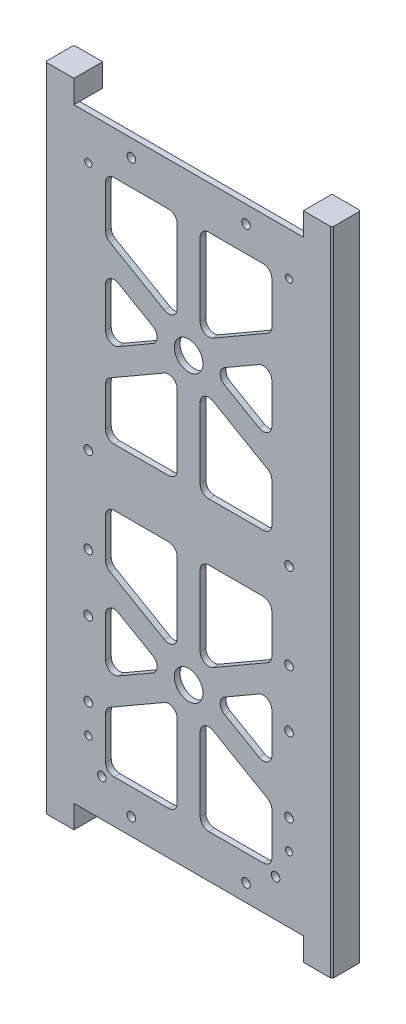
from build123d import *

# Parameters (mm, degrees)
SKETCH1_W                   = 88
SKETCH1_H                   = 211
BOSS_EXTRUDE1_DEPTH         = 2
CUT_EXTRUDE2_DEPTH          = 2
SKETCH4_R                   = 5
CUT_EXTRUDE3_DEPTH          = 229.624145706
FILLET2_R                   = 3
BOSS_EXTRUDE2_DEPTH         = 10
CUT_EXTRUDE5_DEPTH          = 8
SKETCH58_R                  = 1.665
CUT_EXTRUDE9_DEPTH          = 1.8
SKETCH59_R                  = 2
CUT_EXTRUDE10_DEPTH         = 10
FILLET3_SIZE                = 0.5
F_3_0MM_DOWEL_HOLE1_D       = 3
TAP_DRILL_FOR_M3X0_5_TAP1_D = 2.5


with BuildPart() as part:
    # Sketch1 → Boss-Extrude1 (new body)
    with BuildSketch(Plane.XY):
        with Locations((44, 105.5)):
            Rectangle(SKETCH1_W, SKETCH1_H)
    extrude(amount=BOSS_EXTRUDE1_DEPTH)

    # Sketch3 → Cut-Extrude2 (cut)
    with BuildSketch(Plane.XY.offset(2)):
        Polygon((40, 196), (15, 196), (15, 176.61195996), (40, 162.17820323), align=None)
        Polygon((73, 196), (48, 196), (48, 162.17820323), (73, 176.61195996), align=None)
        Polygon((36, 155.25), (15, 167.374355653), (15, 143.125644347), align=None)
        Polygon((40, 148.32179677), (15, 133.88804004), (15, 115.5), (40, 115.5), align=None)
        Polygon((73, 143.125644347), (73, 167.374355653), (52, 155.25), align=None)
        Polygon((73, 115.5), (73, 133.88804004), (48, 148.32179677), (48, 115.5), align=None)
    cut_extrude2 = extrude(amount=-CUT_EXTRUDE2_DEPTH, mode=Mode.SUBTRACT)

    # Sketch4 → Cut-Extrude3 (cut, through all)
    with BuildSketch(Plane.XY.offset(2)):
        with Locations((44, 155.25)):
            Circle(SKETCH4_R)
    cut_extrude3 = extrude(amount=-CUT_EXTRUDE3_DEPTH, mode=Mode.SUBTRACT)

    # Mirror2: Cut-Extrude2, Cut-Extrude3 across plane
    add(cut_extrude2.mirror(Plane(origin=(0, 105.5, 0), x_dir=(0, 0, 1), z_dir=(0, -1, 0))), mode=Mode.SUBTRACT)
    add(cut_extrude3.mirror(Plane(origin=(0, 105.5, 0), x_dir=(0, 0, 1), z_dir=(0, -1, 0))), mode=Mode.SUBTRACT)

    # Fillet2
    fillet2_edges = [part.edges().sort_by_distance(p)[0] for p in [
        (73, 67.874355653, 1),
        (73, 43.625644347, 1),
        (52, 55.75, 1),
        (40, 48.82179677, 1),
        (40, 15, 1),
        (15, 15, 1),
        (15, 34.38804004, 1),
        (15, 143.125644347, 1),
        (15, 167.374355653, 1),
        (36, 155.25, 1),
        (15, 115.5, 1),
        (15, 133.88804004, 1),
        (40, 148.32179677, 1),
        (40, 115.5, 1),
        (48, 196, 1),
        (73, 196, 1),
        (48, 162.17820323, 1),
        (73, 115.5, 1),
        (48, 115.5, 1),
        (48, 148.32179677, 1),
        (73, 133.88804004, 1),
        (15, 196, 1),
        (40, 196, 1),
        (40, 162.17820323, 1),
        (15, 176.61195996, 1),
        (73, 167.374355653, 1),
        (73, 143.125644347, 1),
        (52, 155.25, 1),
        (48, 62.67820323, 1),
        (48, 95.5, 1),
        (73, 95.5, 1),
        (73, 77.11195996, 1),
        (73, 34.38804004, 1),
        (73, 15, 1),
        (48, 15, 1),
        (48, 48.82179677, 1),
        (40, 62.67820323, 1),
        (15, 77.11195996, 1),
        (15, 95.5, 1),
        (40, 95.5, 1),
        (15, 43.625644347, 1),
        (15, 67.874355653, 1),
        (36, 55.75, 1),
        (73, 176.61195996, 1),
    ]]
    fillet(fillet2_edges, radius=FILLET2_R)

    # Sketch7 → Boss-Extrude2 (add)
    with BuildSketch(Plane.XY.offset(2)):
        Polygon((94, 219), (84, 219), (84, 211), (88, 211), (88, 0), (84, 0), (84, -8), (94, -8), align=None)
        Polygon((-6, -8), (4, -8), (4, 0), (0, 0), (0, 211), (4, 211), (4, 219), (-6, 219), align=None)
    extrude(amount=-BOSS_EXTRUDE2_DEPTH)

    # Sketch53 → Cut-Extrude5 (cut)
    with BuildSketch(Plane(origin=(0, 0, -8), x_dir=(-1, 0, 0), z_dir=(0, 0, -1))):
        with BuildLine():
            Line((-90, 0), (-88, 0))
            Line((-88, 0), (-88, 211))
            Line((-88, 211), (-90, 211))
            ThreePointArc((-90, 211), (-91.414213562, 210.414213562), (-92, 209))
            Line((-92, 209), (-92, 2))
            ThreePointArc((-92, 2), (-91.414213562, 0.585786438), (-90, 0))
        make_face()
        with BuildLine():
            Line((4, 2), (4, 209))
            ThreePointArc((4, 209), (3.414213562, 210.414213562), (2, 211))
            Line((2, 211), (-4, 211))
            Line((-4, 211), (-4, 0))
            Line((-4, 0), (2, 0))
            ThreePointArc((2, 0), (3.414213562, 0.585786438), (4, 2))
        make_face()
    extrude(amount=-CUT_EXTRUDE5_DEPTH, mode=Mode.SUBTRACT)

    # Sketch58 → Cut-Extrude9 (cut)
    with BuildSketch(Plane(origin=(0, 0, 0), x_dir=(-1, 0, 0), z_dir=(0, 0, -1))):
        with Locations((-0.7, 13)):
            Circle(SKETCH58_R)
    cut_extrude9 = extrude(amount=-CUT_EXTRUDE9_DEPTH, mode=Mode.SUBTRACT)

    # Mirror4: Cut-Extrude9 across plane
    add(cut_extrude9.mirror(Plane(origin=(44, 0, 0), x_dir=(0, 0, 1), z_dir=(1, 0, 0))), mode=Mode.SUBTRACT)

    # Sketch59 → Cut-Extrude10 (cut)
    with BuildSketch(Plane(origin=(0, -8, 0), x_dir=(-1, 0, 0), z_dir=(0, -1, 0))):
        with Locations((-89, 2.4)):
            Circle(SKETCH59_R)
        with Locations((1, 2.4)):
            Circle(SKETCH59_R)
    extrude(amount=-CUT_EXTRUDE10_DEPTH, mode=Mode.SUBTRACT)

    # Fillet3
    fillet3_edges = [part.edges().sort_by_distance(p)[0] for p in [
        (-6, 105.5, 2),
        (-6, 105.5, -8),
        (94, 105.5, -8),
        (94, 105.5, 2),
    ]]
    chamfer(fillet3_edges, length=FILLET3_SIZE)

    # Ø3.0mm Dowel Hole1 (through all)
    with Locations(Plane.XY.offset(2)):
        with Locations((24, 205), (64, 205), (9, 109.2), (79, 109.2), (9, 79.2), (79, 79.2), (9, 59.2), (79, 59.2), (9, 33.2), (79, 33.2), (13.7, 13), (24, 6), (74.3, 13), (64, 6)):
            Hole(F_3_0MM_DOWEL_HOLE1_D / 2)

    # Tap Drill for M3x0.5 Tap1 (through all)
    with Locations(Plane.XY.offset(2)):
        with Locations((9, 196), (79, 196), (9, 23), (79, 23)):
            Hole(TAP_DRILL_FOR_M3X0_5_TAP1_D / 2)


solid = part.part
